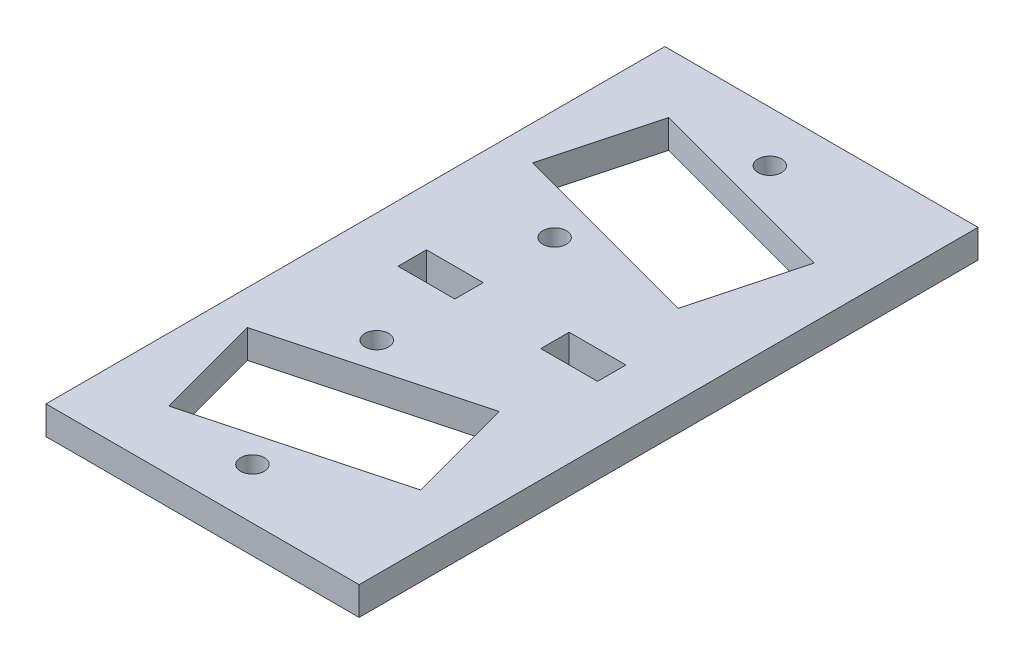
from build123d import *

# Parameters (mm, degrees)
SKETCH1_W           = 35
SKETCH1_H           = 69.175906694
SKETCH1_R           = 1.324800001
SKETCH1_W_2         = 6.35
SKETCH1_H_2         = 3.175
BOSS_EXTRUDE1_DEPTH = 3.175


with BuildPart() as part:
    # Sketch1 → Boss-Extrude1 (new body)
    with BuildSketch(Plane(origin=(0, 0, 0), x_dir=(1, 0, 0), z_dir=(0, 1, 0))):
        with Locations((254.40748173, -4.806781058)):
            Rectangle(SKETCH1_W, SKETCH1_H)
        with Locations((254.31079756, 24.107146731)):
            Circle(SKETCH1_R, mode=Mode.SUBTRACT)
        with Locations((249.226245104, 5.131338633)):
            Circle(SKETCH1_R, mode=Mode.SUBTRACT)
        with Locations((249.226245104, -14.744900749)):
            Circle(SKETCH1_R, mode=Mode.SUBTRACT)
        with Locations((254.31079756, -33.720708847)):
            Circle(SKETCH1_R, mode=Mode.SUBTRACT)
        Polygon((240.775666346, 11.14605698), (262.991960351, 5.193218942), (266.20131651, 17.170699188), (243.985022505, 23.123537226), align=None, mode=Mode.SUBTRACT)
        Polygon((262.991960351, -14.806781058), (266.20131651, -26.784261304), (243.985022505, -32.737099341), (240.775666346, -20.759619095), align=None, mode=Mode.SUBTRACT)
        with Locations((246.43248173, -4.806781058)):
            Rectangle(SKETCH1_W_2, SKETCH1_H_2, mode=Mode.SUBTRACT)
        with Locations((262.38248173, -4.806781058)):
            Rectangle(SKETCH1_W_2, SKETCH1_H_2, mode=Mode.SUBTRACT)
    extrude(amount=BOSS_EXTRUDE1_DEPTH)


solid = part.part
